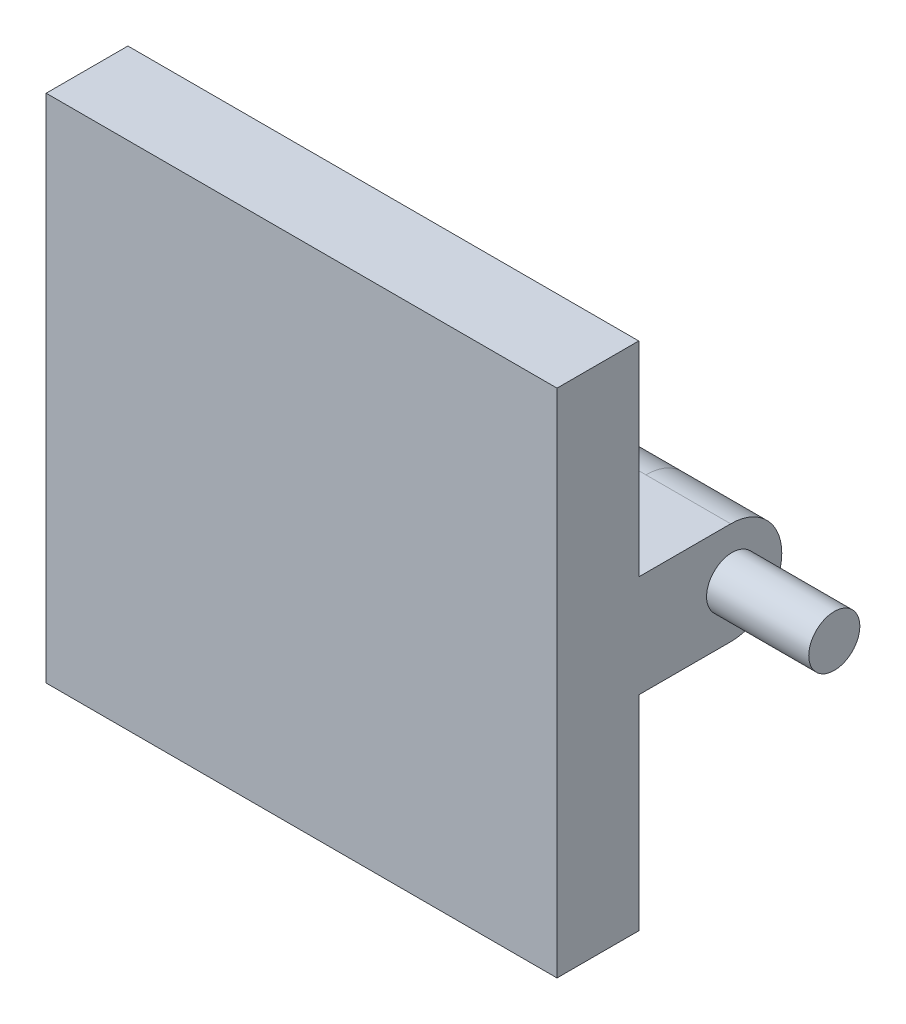
from build123d import *

# Parameters (mm, degrees)
SKETCH1_R            = 12.7
BOSS_EXTRUDE3_DEPTH  = 152.4
SKETCH9_R            = 6.35
BOSS_EXTRUDE6_DEPTH  = 19.05
SKETCH16_W           = 25.4
SKETCH16_H           = 63.5
CUT_EXTRUDE2_DEPTH   = 155.762931731
SKETCH17_W           = 25.4
SKETCH17_H           = 63.5
CUT_EXTRUDE3_DEPTH   = 155.762931731
SKETCH19_R           = 2.54
CUT_EXTRUDE5_DEPTH   = 155.762931731
SKETCH21_W           = 21.59
SKETCH21_H           = 12.7
BOSS_EXTRUDE8_DEPTH  = 12.7
BOSS_EXTRUDE9_DEPTH  = 6.35
SKETCH25_R           = 3.175
CUT_EXTRUDE7_DEPTH   = 21.59
SKETCH29_R           = 2.921
BOSS_EXTRUDE10_DEPTH = 35.814
FILLET2_R            = 6.35
FILLET3_R            = 6.35
SKETCH31_W           = 63.5
SKETCH31_H           = 63.5
BOSS_EXTRUDE11_DEPTH = 10.16
SKETCH32_W           = 127
SKETCH32_H           = 307.417558359
CUT_EXTRUDE8_DEPTH   = 195.047688304
SKETCH33_W           = 21.59
SKETCH33_H           = 12.7
CUT_EXTRUDE9_DEPTH   = 195.047688304
SKETCH29_2_R         = 2.921
BOSS_EXTRUDE12_DEPTH = 35.814
SKETCH37_W           = 17.78
SKETCH37_H           = 12.7
BOSS_EXTRUDE13_DEPTH = 10.541
FILLET5_R            = 6.35
SKETCH38_R           = 3.175
BOSS_EXTRUDE14_DEPTH = 12.7


with BuildPart() as part:
    # Sketch1 → Boss-Extrude3 (new, symmetric)
    with BuildSketch(Plane.XY):
        with Locations(Location((0, 0, 0), (0, 0, 180))):
            Circle(SKETCH1_R)
    extrude(amount=BOSS_EXTRUDE3_DEPTH, both=True)

    # Sketch9 → Boss-Extrude6 (add, symmetric)
    with BuildSketch(Plane(origin=(0, 0, 0), x_dir=(0, 0, -1), z_dir=(1, 0, 0))):
        with Locations((-25.4, 0)):
            Circle(SKETCH9_R)
    extrude(amount=BOSS_EXTRUDE6_DEPTH, both=True)

    # Sketch16 → Cut-Extrude2 (cut, through all)
    with BuildSketch(Plane(origin=(0, -6.35, 0), x_dir=(1, 0, 0), z_dir=(0, 1, 0))):
        with Locations((0, 120.65)):
            Rectangle(SKETCH16_W, SKETCH16_H)
    extrude(amount=-CUT_EXTRUDE2_DEPTH, mode=Mode.SUBTRACT)

    # Sketch17 → Cut-Extrude3 (cut, through all)
    with BuildSketch(Plane(origin=(0, 6.35, 0), x_dir=(1, 0, 0), z_dir=(0, 1, 0))):
        with Locations((0, 120.65)):
            Rectangle(SKETCH17_W, SKETCH17_H)
    extrude(amount=CUT_EXTRUDE3_DEPTH, mode=Mode.SUBTRACT)

    # Sketch19 → Cut-Extrude5 (cut, through all)
    with BuildSketch(Plane(origin=(0, 6.35, 0), x_dir=(1, 0, 0), z_dir=(0, 1, 0))):
        with Locations(Location((0, 100.80625, 0), (0, 0, 270))):
            Circle(SKETCH19_R)
        with Locations(Location((0, 136.525, 0), (0, 0, 270))):
            Circle(SKETCH19_R)
    extrude(amount=-CUT_EXTRUDE5_DEPTH, mode=Mode.SUBTRACT)

    # Sketch21 → Boss-Extrude8 (add)
    with BuildSketch(Plane.XY.offset(152.4)):
        Rectangle(SKETCH21_W, SKETCH21_H)
    extrude(amount=BOSS_EXTRUDE8_DEPTH)

    # Sketch25 → Cut-Extrude7 (cut)
    with BuildSketch(Plane.ZY.offset(10.795)):
        with Locations(Location((158.75, 0, 0), (0, 0, 270))):
            Circle(SKETCH25_R)
    extrude(amount=-CUT_EXTRUDE7_DEPTH, mode=Mode.SUBTRACT)

    # Fillet3
    fillet3_edges = [part.edges().sort_by_distance(p)[0] for p in [
        (0, -6.35, 165.1),
        (0, 6.35, 165.1),
    ]]
    fillet(fillet3_edges, radius=FILLET3_R - 0.0001)  # a hair under: the kernel refuses the full size

    # Sketch32 → Cut-Extrude8 (cut, through all)
    with BuildSketch(Plane(origin=(0, 31.75, 0), x_dir=(1, 0, 0), z_dir=(0, 1, 0))):
        with Locations((19.549323816, 1.30877918)):
            Rectangle(SKETCH32_W, SKETCH32_H)
    extrude(amount=-CUT_EXTRUDE8_DEPTH, mode=Mode.SUBTRACT)


with BuildPart() as body_2:
    # Sketch27 → Boss-Extrude9 (new, symmetric)
    with BuildSketch(Plane(origin=(0, 0, 0), x_dir=(1, 0, 0), z_dir=(0, 1, 0))):
        Polygon((0, -165.354), (11.049, -165.354), (11.049, -152.654), (21.209, -152.654), (21.209, -170.434), (-21.209, -170.434), (-21.209, -152.654), (-11.049, -152.654), (-11.049, -165.354), align=None)
    extrude(amount=BOSS_EXTRUDE9_DEPTH, both=True)

    # Sketch29 → Boss-Extrude10 (add)
    with BuildSketch(Plane.ZY.offset(21.209)):
        with Locations((158.827896988, 0)):
            Circle(SKETCH29_R)
    extrude(amount=-BOSS_EXTRUDE10_DEPTH)

    # Fillet2
    fillet2_edges = [body_2.edges().sort_by_distance(p)[0] for p in [
        (16.129, -6.35, 152.654),
        (16.129, 6.35, 152.654),
        (-16.129, -6.35, 152.654),
        (-16.129, 6.35, 152.654),
    ]]
    fillet(fillet2_edges, radius=FILLET2_R - 0.0001)  # a hair under: the kernel refuses the full size

    # Sketch31 → Boss-Extrude11 (add)
    with BuildSketch(Plane.XY.offset(170.434)):
        Rectangle(SKETCH31_W, SKETCH31_H)
    extrude(amount=BOSS_EXTRUDE11_DEPTH)


with BuildPart() as cut_extrude9_tool:
    # Sketch33 → Cut-Extrude9 (new, through all)
    with BuildSketch(Plane(origin=(0, 31.75, 0), x_dir=(1, 0, 0), z_dir=(0, 1, 0))):
        with Locations((0, -158.75)):
            Rectangle(SKETCH33_W, SKETCH33_H)
    extrude(amount=-CUT_EXTRUDE9_DEPTH)


with BuildPart() as part_1:
    add(part.part)

    # Cut-Extrude9: cut by cut_extrude9_tool
    add(cut_extrude9_tool.part, mode=Mode.SUBTRACT)


with BuildPart() as body_2_1:
    add(body_2.part)

    # Cut-Extrude9: cut by cut_extrude9_tool
    add(cut_extrude9_tool.part, mode=Mode.SUBTRACT)

    # Sketch29<2> → Boss-Extrude12 (add)
    with BuildSketch(Plane.ZY.offset(21.209)):
        with Locations((158.827896988, 0)):
            Circle(SKETCH29_2_R)
    extrude(amount=-BOSS_EXTRUDE12_DEPTH)

    # Sketch37 → Boss-Extrude13 (add)
    with BuildSketch(Plane(origin=(21.209, 0, 0), x_dir=(0, 0, -1), z_dir=(1, 0, 0))):
        with Locations((-161.544, 0)):
            Rectangle(SKETCH37_W, SKETCH37_H)
    extrude(amount=BOSS_EXTRUDE13_DEPTH)

    # Fillet5
    fillet5_edges = [body_2_1.edges().sort_by_distance(p)[0] for p in [
        (26.4795, -6.35, 152.654),
        (26.4795, 6.35, 152.654),
    ]]
    fillet(fillet5_edges, radius=FILLET5_R - 0.0001)  # a hair under: the kernel refuses the full size

    # Sketch38 → Boss-Extrude14 (add)
    with BuildSketch(Plane(origin=(31.75, 0, 0), x_dir=(0, 0, -1), z_dir=(1, 0, 0))):
        with Locations(Location((-158.827896988, 0, 0), (0, 0, 180))):
            Circle(SKETCH38_R)
    extrude(amount=BOSS_EXTRUDE14_DEPTH)


solid = body_2_1.part
